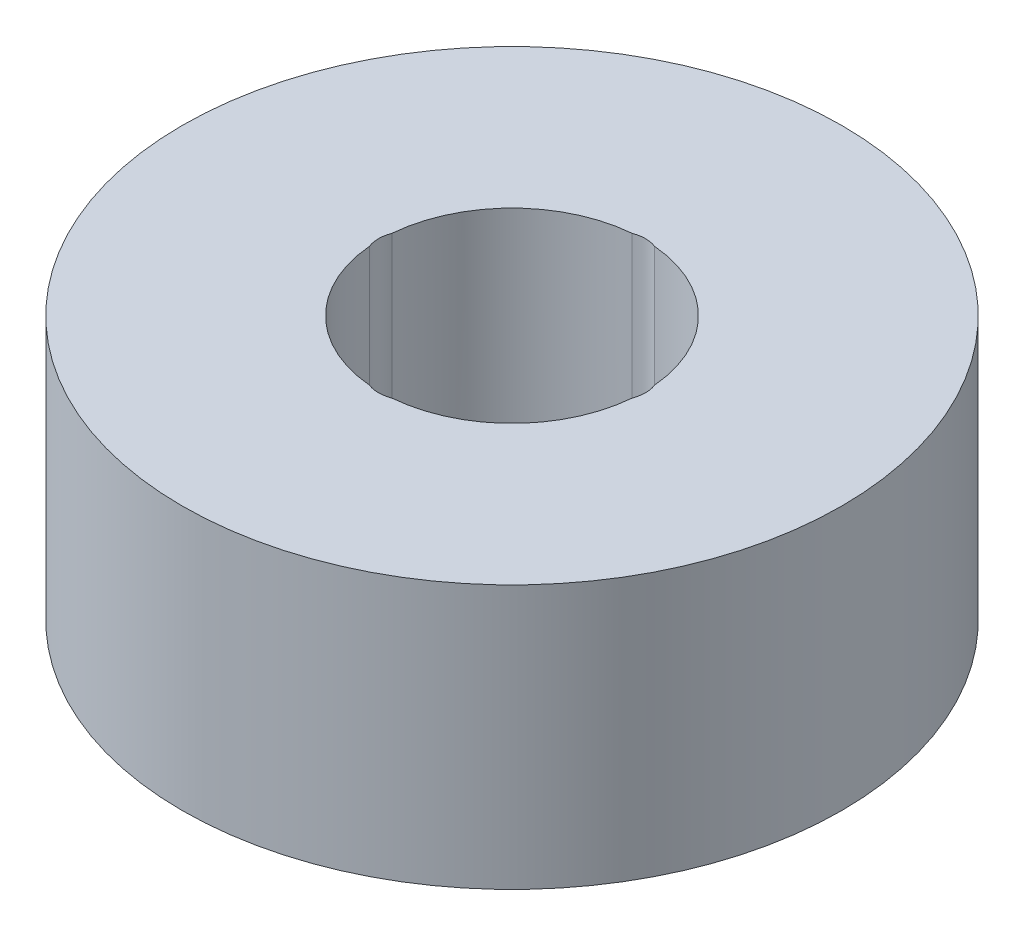
from build123d import *

# Parameters (mm, degrees)
SKETCH1_R           = 25
BOSS_EXTRUDE1_DEPTH = 20
SKETCH2_R           = 10
CUT_EXTRUDE1_DEPTH  = 41.620192023
SKETCH3_R           = 2.359593584
CUT_EXTRUDE2_DEPTH  = 13.547696906
CIRPATTERN1_COUNT   = 4


with BuildPart() as part:
    # Sketch1 → Boss-Extrude1 (new body)
    with BuildSketch(Plane(origin=(0, 0, 0), x_dir=(1, 0, 0), z_dir=(0, 1, 0))):
        Circle(SKETCH1_R)
    extrude(amount=BOSS_EXTRUDE1_DEPTH)

    # Sketch2 → Cut-Extrude1 (cut, through all)
    with BuildSketch(Plane(origin=(0, 0, 0), x_dir=(1, 0, 0), z_dir=(0, 1, 0))):
        Circle(SKETCH2_R)
    extrude(amount=CUT_EXTRUDE1_DEPTH, mode=Mode.SUBTRACT)

    # Sketch3 → Cut-Extrude2 (cut)
    with BuildSketch(Plane(origin=(0, 20, 0), x_dir=(1, 0, 0), z_dir=(0, 1, 0))):
        with Locations((-7.763889909, 0)):
            Circle(SKETCH3_R)
    cut_extrude2 = extrude(amount=-CUT_EXTRUDE2_DEPTH, mode=Mode.SUBTRACT)

    # CirPattern1: Cut-Extrude2 ×4 about axis
    cirpattern1_axis = Axis((0, 0, 0), (0, 1, 0))
    for i in range(1, CIRPATTERN1_COUNT):
        add(cut_extrude2.rotate(cirpattern1_axis, i * 360 / CIRPATTERN1_COUNT), mode=Mode.SUBTRACT)


solid = part.part
